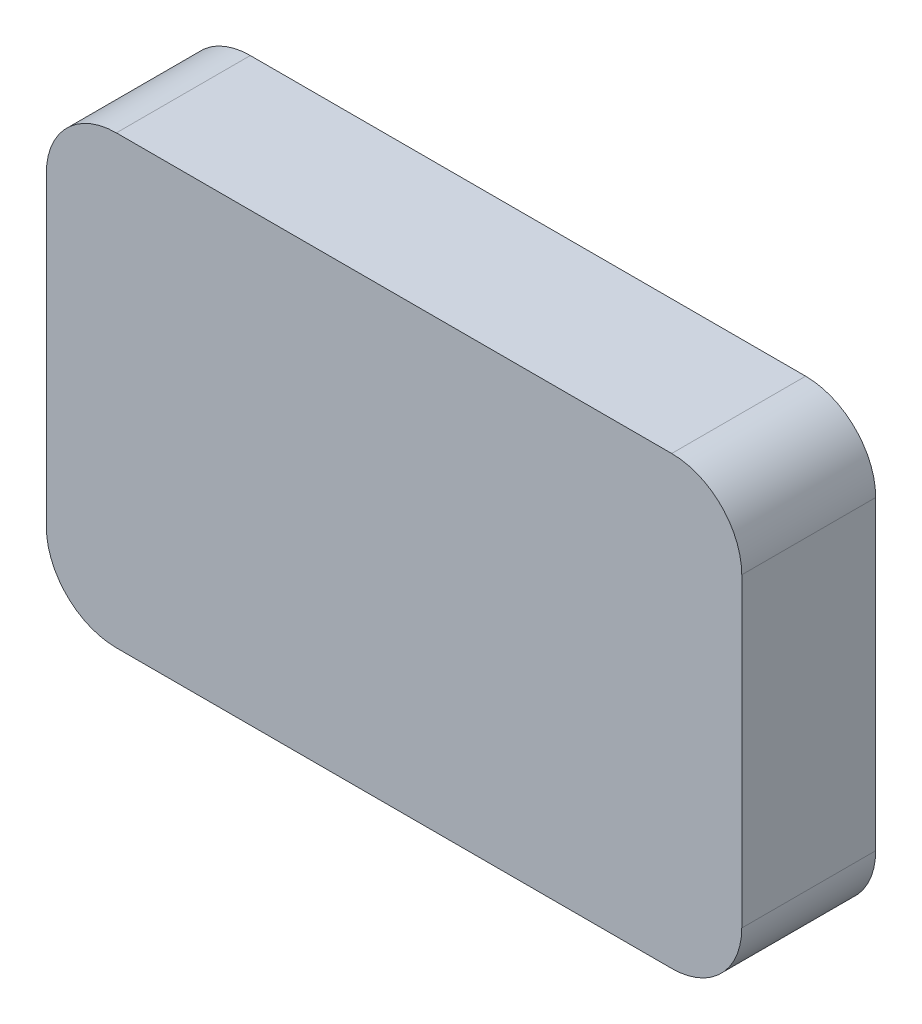
from build123d import *

# Parameters (mm, degrees)
BOSS_EXTRU_1_DEPTH = 1.2
CONG_1_R           = 2


with BuildPart() as part:
    # Balayage1: sweep along a path in Esquisse1
    with BuildLine(Plane.XY) as balayage1_path:
        Line((-39.634177347, 31.830613733), (39.634177347, 31.830613733))
        ThreePointArc((39.634177347, 31.830613733), (46.705245159, 28.901681545), (49.634177347, 21.830613733))
        Line((49.634177347, 21.830613733), (49.634177347, -21.830613733))
        ThreePointArc((49.634177347, -21.830613733), (46.705245159, -28.901681545), (39.634177347, -31.830613733))
        Line((39.634177347, -31.830613733), (-39.634177347, -31.830613733))
        ThreePointArc((-39.634177347, -31.830613733), (-46.705245159, -28.901681545), (-49.634177347, -21.830613733))
        Line((-49.634177347, -21.830613733), (-49.634177347, 21.830613733))
        ThreePointArc((-49.634177347, 21.830613733), (-46.705245159, 28.901681545), (-39.634177347, 31.830613733))
    # profil → Balayage1 (sweep)
    with BuildSketch(Plane(origin=(0, 0, 0), x_dir=(0, 0, -1), z_dir=(1, 0, 0))):
        with BuildLine():
            Line((0, -30.230613733), (9.122494235, -30.230613733))
            Line((9.122494235, -30.230613733), (17.918249503, -25.630613733))
            Line((17.918249503, -25.630613733), (17.918249503, -27.230613733))
            ThreePointArc((17.918249503, -27.230613733), (19.418249503, -28.730613733), (17.918249503, -30.230613733))
            Line((17.918249503, -30.230613733), (17.918249503, -31.830613733))
            Line((17.918249503, -31.830613733), (0, -31.830613733))
            Line((0, -31.830613733), (0, -30.230613733))
        make_face()
    sweep(path=balayage1_path.line)

    # Esquisse1<3> → Boss.-Extru.1 (add)
    with BuildSketch(Plane.XY):
        with BuildLine():
            Line((-39.634177347, 31.830613733), (39.634177347, 31.830613733))
            ThreePointArc((39.634177347, 31.830613733), (46.705245159, 28.901681545), (49.634177347, 21.830613733))
            Line((49.634177347, 21.830613733), (49.634177347, -21.830613733))
            ThreePointArc((49.634177347, -21.830613733), (46.705245159, -28.901681545), (39.634177347, -31.830613733))
            Line((39.634177347, -31.830613733), (-39.634177347, -31.830613733))
            ThreePointArc((-39.634177347, -31.830613733), (-46.705245159, -28.901681545), (-49.634177347, -21.830613733))
            Line((-49.634177347, -21.830613733), (-49.634177347, 21.830613733))
            ThreePointArc((-49.634177347, 21.830613733), (-46.705245159, 28.901681545), (-39.634177347, 31.830613733))
        make_face()
    extrude(amount=BOSS_EXTRU_1_DEPTH)

    # Congé1
    cong_1_edges = [part.edges().sort_by_distance(p)[0] for p in [
        (-45.573874309, 27.770310695, 0),
        (-48.034177347, 0, 0),
        (-45.573874309, -27.770310695, 0),
        (0, -30.230613733, 0),
        (0, -30.230613733, 0),
        (45.573874309, -27.770310695, 0),
        (48.034177347, 0, 0),
        (45.573874309, 27.770310695, 0),
        (0, 30.230613733, 0),
    ]]
    fillet(cong_1_edges, radius=CONG_1_R)


solid = part.part
